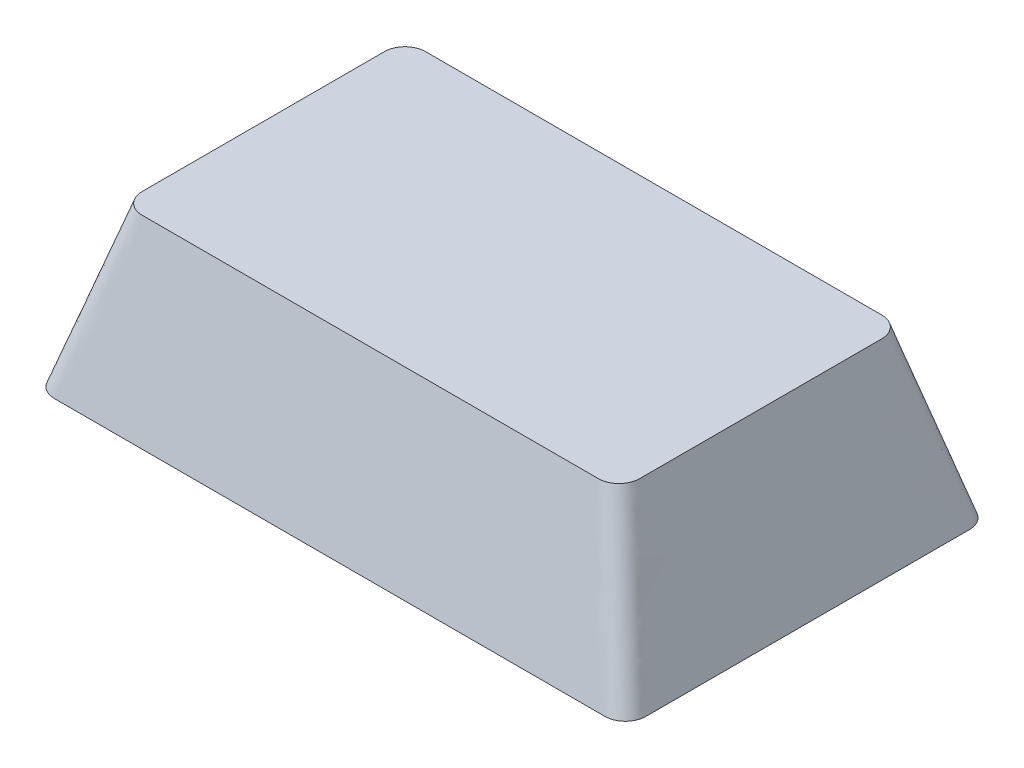
from build123d import *


with BuildPart() as part:
    # Croquis3 for Recubrir1 → Recubrir1 section 0
    with BuildSketch(Plane(origin=(0, 8.001, 0), x_dir=(1, 0, 0), z_dir=(0, 1, 0))):
        with BuildLine():
            Line((-11.2649, -6.9977), (11.2649, -6.9977))
            # circular arc as an exact rational Bezier (weights 1, cos(half-angle), 1)
            Bezier((11.2649, -6.9977), (12.2809, -6.9977), (12.2809, -5.9817), weights=[1, 0.707106781, 1])
            Line((12.2809, -5.9817), (12.2809, 5.9817))
            Bezier((12.2809, 5.9817), (12.2809, 6.9977), (11.2649, 6.9977), weights=[1, 0.707106781, 1])
            Line((11.2649, 6.9977), (-11.2649, 6.9977))
            Bezier((-11.2649, 6.9977), (-12.2809, 6.9977), (-12.2809, 5.9817), weights=[1, 0.707106781, 1])
            Line((-12.2809, 5.9817), (-12.2809, -5.9817))
            Bezier((-12.2809, -5.9817), (-12.2809, -6.9977), (-11.2649, -6.9977), weights=[1, 0.707106781, 1])
        make_face()
    # Croquis2 for Recubrir1 → Recubrir1 section 1
    with BuildSketch(Plane(origin=(0, 0, 0), x_dir=(1, 0, 0), z_dir=(0, 1, 0))):
        with BuildLine():
            Line((-13.589, -9.0043), (13.589, -9.0043))
            Bezier((13.589, -9.0043), (14.605, -9.0043), (14.605, -7.9883), weights=[1, 0.707106781, 1])
            Line((14.605, -7.9883), (14.605, 7.9883))
            Bezier((14.605, 7.9883), (14.605, 9.0043), (13.589, 9.0043), weights=[1, 0.707106781, 1])
            Line((13.589, 9.0043), (-13.589, 9.0043))
            Bezier((-13.589, 9.0043), (-14.605, 9.0043), (-14.605, 7.9883), weights=[1, 0.707106781, 1])
            Line((-14.605, 7.9883), (-14.605, -7.9883))
            Bezier((-14.605, -7.9883), (-14.605, -9.0043), (-13.589, -9.0043), weights=[1, 0.707106781, 1])
        make_face()
    loft()


solid = part.part
